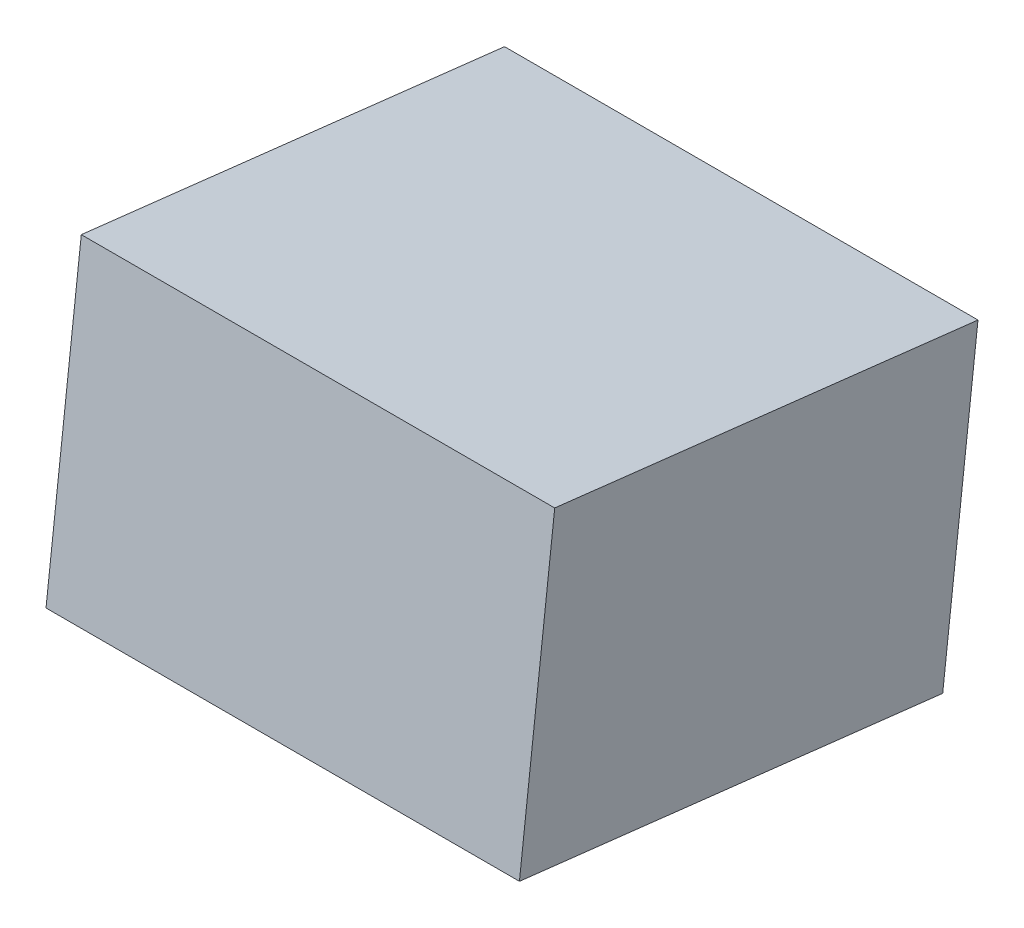
from build123d import *

# Parameters (mm, degrees)
SKETCH1_W           = 200
SKETCH1_H           = 180
BOSS_EXTRUDE1_DEPTH = 130


with BuildPart() as part:
    # Sketch1 → Boss-Extrude1 (new body)
    with BuildSketch(Plane(origin=(0, 358.879876801, -41.422455829), x_dir=(1, 0, 0), z_dir=(-6.837425950214788e-15, 0.9934047622419533, -0.1146602736566085))):
        with Locations((-135, 211.357042425)):
            Rectangle(SKETCH1_W, SKETCH1_H)
    extrude(amount=BOSS_EXTRUDE1_DEPTH)


solid = part.part
